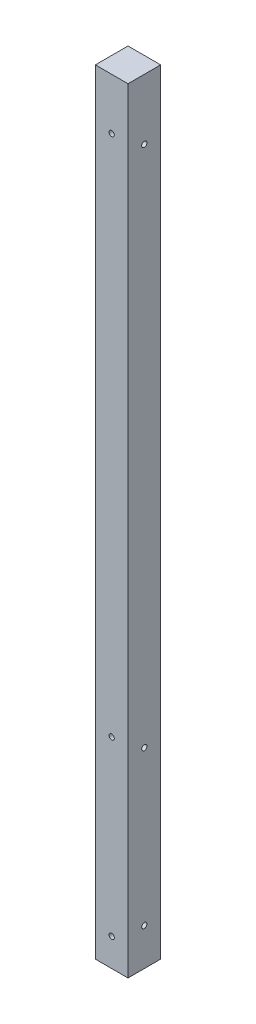
from build123d import *

# Parameters (mm, degrees)
SKETCH1_W           = 88.9
SKETCH1_H           = 88.9
BOSS_EXTRUDE2_DEPTH = 2108.2
SKETCH2_R           = 7.14375
CUT_EXTRUDE1_DEPTH  = 2111.541696461
SKETCH3_R           = 7.14375
CUT_EXTRUDE2_DEPTH  = 2111.541696461


with BuildPart() as part:
    # Sketch1 → Boss-Extrude2 (new body)
    with BuildSketch(Plane(origin=(0, 0, 0), x_dir=(1, 0, 0), z_dir=(0, 1, 0))):
        Rectangle(SKETCH1_W, SKETCH1_H)
    extrude(amount=BOSS_EXTRUDE2_DEPTH)

    # Sketch2 → Cut-Extrude1 (cut, through all)
    with BuildSketch(Plane.XY.offset(44.45)):
        with Locations((0, 76.2)):
            Circle(SKETCH2_R)
        with Locations((0, 546.1)):
            Circle(SKETCH2_R)
        with Locations((0, 1968.5)):
            Circle(SKETCH2_R)
    extrude(amount=-CUT_EXTRUDE1_DEPTH, mode=Mode.SUBTRACT)

    # Sketch3 → Cut-Extrude2 (cut, through all)
    with BuildSketch(Plane(origin=(44.45, 0, 0), x_dir=(0, 0, -1), z_dir=(1, 0, 0))):
        with Locations((0, 101.6)):
            Circle(SKETCH3_R)
        with Locations((0, 520.7)):
            Circle(SKETCH3_R)
        with Locations((0, 1943.1)):
            Circle(SKETCH3_R)
    extrude(amount=-CUT_EXTRUDE2_DEPTH, mode=Mode.SUBTRACT)


solid = part.part
